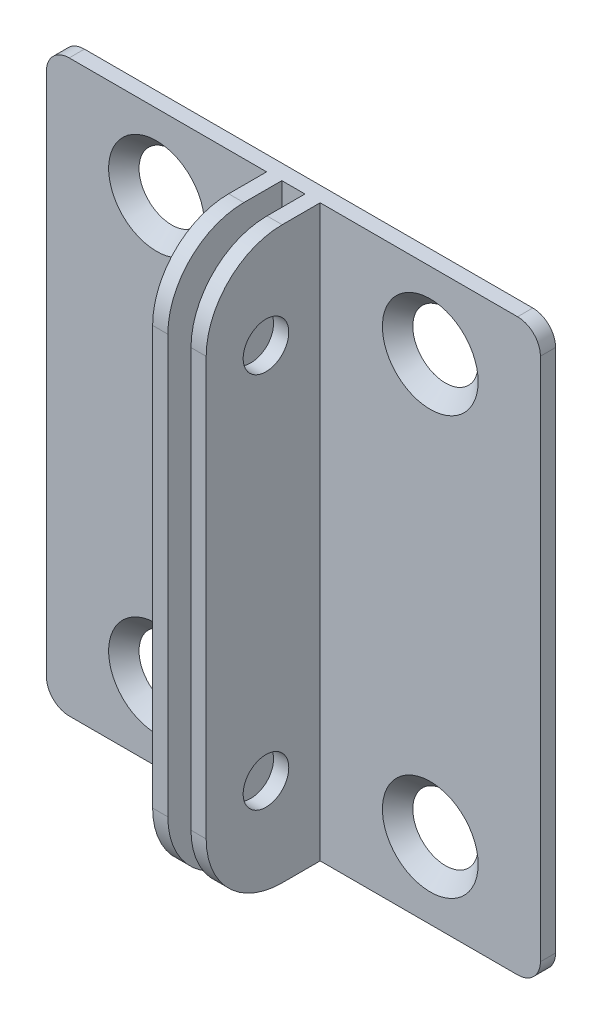
from build123d import *

# Parameters (mm, degrees)
ESQUISSE1_W             = 65
ESQUISSE1_H             = 75
BOSS_EXTRU_1_DEPTH      = 2
ESQUISSE2_W             = 2
ESQUISSE2_H             = 75
BOSS_EXTRU_2_DEPTH      = 15
CONG_1_R                = 3
CONG_2_R                = 10
ESQUISSE6_R             = 3
ENL_V_MAT_EXTRU_1_DEPTH = 15


# Read off the part's stored shape, not the designer's step: Fraisage pour vis à tête fraisée M61
with BuildPart() as part:
    # Esquisse1 → Boss.-Extru.1 (new body)
    with BuildSketch(Plane.XY):
        with Locations((32.5, 37.5)):
            Rectangle(ESQUISSE1_W, ESQUISSE1_H)
    extrude(amount=BOSS_EXTRU_1_DEPTH)

    # Esquisse2 → Boss.-Extru.2 (add)
    with BuildSketch(Plane.XY.offset(2)):
        with Locations((29.976787497, 37.5)):
            Rectangle(ESQUISSE2_W, ESQUISSE2_H)
        with Locations((35.023212503, 37.5)):
            Rectangle(ESQUISSE2_W, ESQUISSE2_H)
    extrude(amount=BOSS_EXTRU_2_DEPTH)

    # Congé1
    cong_1_edges = [part.edges().sort_by_distance(p)[0] for p in [
        (0, 75, 1),
        (65, 75, 1),
        (65, 0, 1),
        (0, 0, 1),
    ]]
    fillet(cong_1_edges, radius=CONG_1_R)

    # Congé2
    cong_2_edges = [part.edges().sort_by_distance(p)[0] for p in [
        (35.023212503, 0, 17),
        (35.023212503, 75, 17),
        (29.976787497, 75, 17),
        (29.976787497, 0, 17),
    ]]
    fillet(cong_2_edges, radius=CONG_2_R)

    # Fraisage pour vis à tête fraisée M61 out → Fraisage pour vis à tête fraisée M61 (revolve, cut)
    with BuildSketch(Plane(origin=(50.511606252, 65, 0), x_dir=(1, 0, 0), z_dir=(0, -1, 0))):
        Polygon((6.3, 2), (0, 2), (0, 0), (4.3, 0), align=None)
    revolve(axis=Axis((50.511606252, 65, 0), (0, 0, 1)), mode=Mode.SUBTRACT)

    # Fraisage pour vis _ t_te frais_e M61 2 o → Fraisage pour vis _ t_te frais_e M61 2 (revolve, cut)
    with BuildSketch(Plane(origin=(50.511606252, 10, 0), x_dir=(1, 0, 0), z_dir=(0, -1, 0))):
        Polygon((6.3, 2), (0, 2), (0, 0), (4.3, 0), align=None)
    revolve(axis=Axis((50.511606252, 10, 0), (0, 0, 1)), mode=Mode.SUBTRACT)

    # Fraisage pour vis _ t_te frais_e M61 3 o → Fraisage pour vis _ t_te frais_e M61 3 (revolve, cut)
    with BuildSketch(Plane(origin=(14.488393748, 10, 0), x_dir=(1, 0, 0), z_dir=(0, -1, 0))):
        Polygon((6.3, 2), (0, 2), (0, 0), (4.3, 0), align=None)
    revolve(axis=Axis((14.488393748, 10, 0), (0, 0, 1)), mode=Mode.SUBTRACT)

    # Fraisage pour vis _ t_te frais_e M61 4 o → Fraisage pour vis _ t_te frais_e M61 4 (revolve, cut)
    with BuildSketch(Plane(origin=(14.488393748, 65, 0), x_dir=(1, 0, 0), z_dir=(0, -1, 0))):
        Polygon((6.3, 2), (0, 2), (0, 0), (4.3, 0), align=None)
    revolve(axis=Axis((14.488393748, 65, 0), (0, 0, 1)), mode=Mode.SUBTRACT)

    # Esquisse6 → Enlèv. mat.-Extru.1 (cut)
    with BuildSketch(Plane(origin=(36.023212503, 0, 0), x_dir=(0, 0, -1), z_dir=(1, 0, 0))):
        with Locations(Location((-9.133710771, 62.312214024, 0), (0, 0, 90))):
            Circle(ESQUISSE6_R)
        with Locations(Location((-9.133710771, 12.687785976, 0), (0, 0, 90))):
            Circle(ESQUISSE6_R)
    extrude(amount=-ENL_V_MAT_EXTRU_1_DEPTH, mode=Mode.SUBTRACT)


solid = part.part
